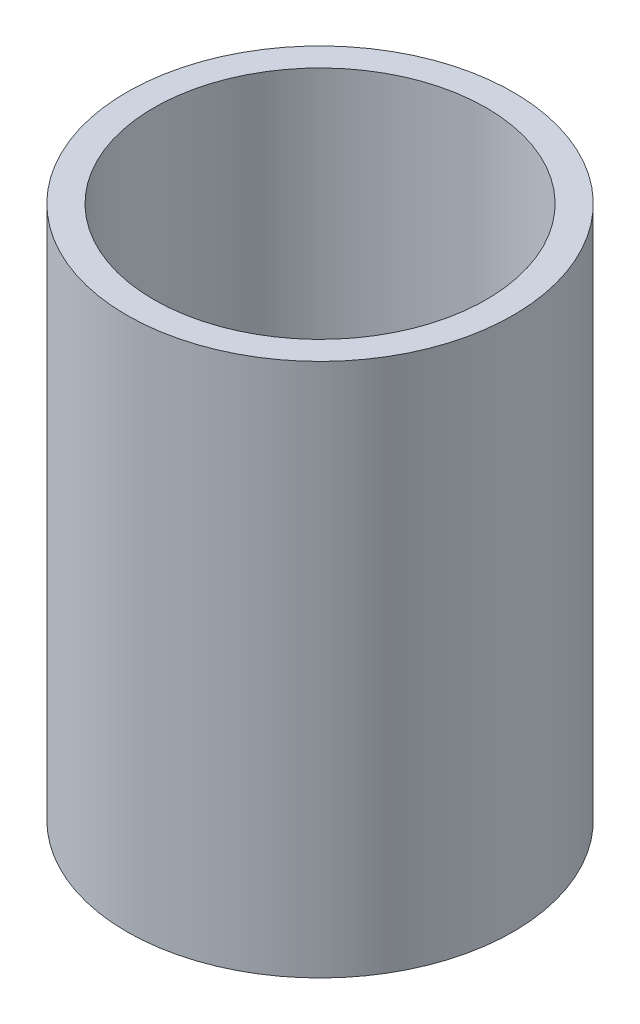
from build123d import *

# Parameters (mm, degrees)
SKETCH1_R           = 47.5
BOSS_EXTRUDE1_DEPTH = 131.274104424
SKETCH2_R           = 40.866245426
CUT_EXTRUDE1_DEPTH  = 148.463183515


with BuildPart() as part:
    # Sketch1 → Boss-Extrude1 (new body)
    with BuildSketch(Plane(origin=(0, 0, 0), x_dir=(1, 0, 0), z_dir=(0, 1, 0))):
        Circle(SKETCH1_R)
    extrude(amount=BOSS_EXTRUDE1_DEPTH)

    # Sketch2 → Cut-Extrude1 (cut, through all)
    with BuildSketch(Plane(origin=(0, 0, 0), x_dir=(1, 0, 0), z_dir=(0, 1, 0))):
        Circle(SKETCH2_R)
    extrude(amount=CUT_EXTRUDE1_DEPTH, mode=Mode.SUBTRACT)


solid = part.part
